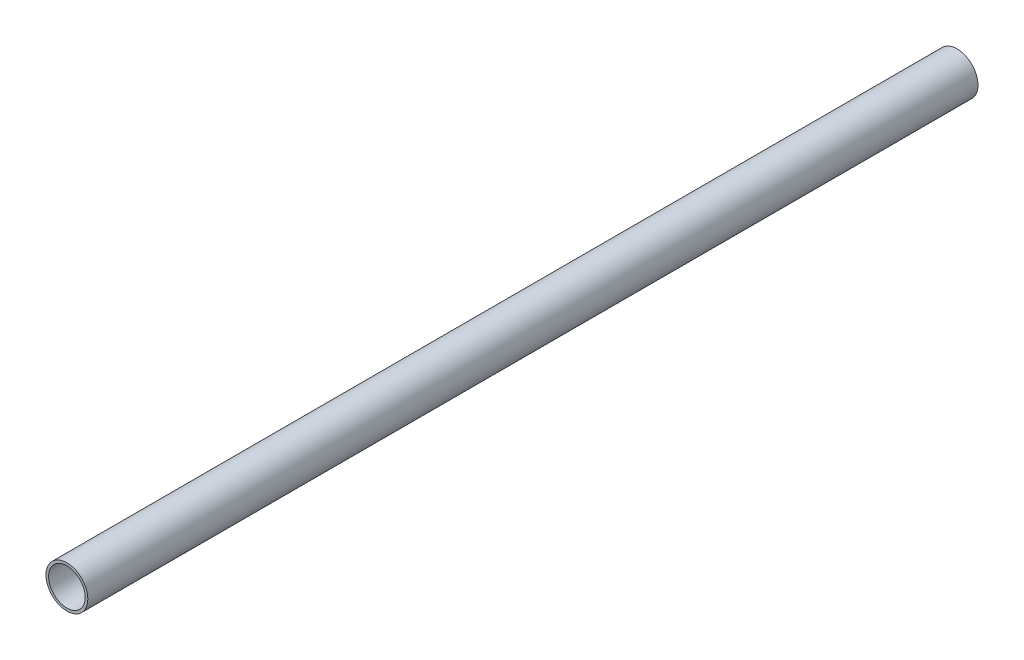
from build123d import *

# Parameters (mm, degrees)
SKETCH2_R           = 12.7
SKETCH2_R_2         = 11.1125
BOSS_EXTRUDE1_DEPTH = 270.100000058


with BuildPart() as part:
    # Sketch2 → Boss-Extrude1 (new, symmetric)
    with BuildSketch(Plane.XY):
        Circle(SKETCH2_R)
        Circle(SKETCH2_R_2, mode=Mode.SUBTRACT)
    extrude(amount=BOSS_EXTRUDE1_DEPTH, both=True)


solid = part.part
